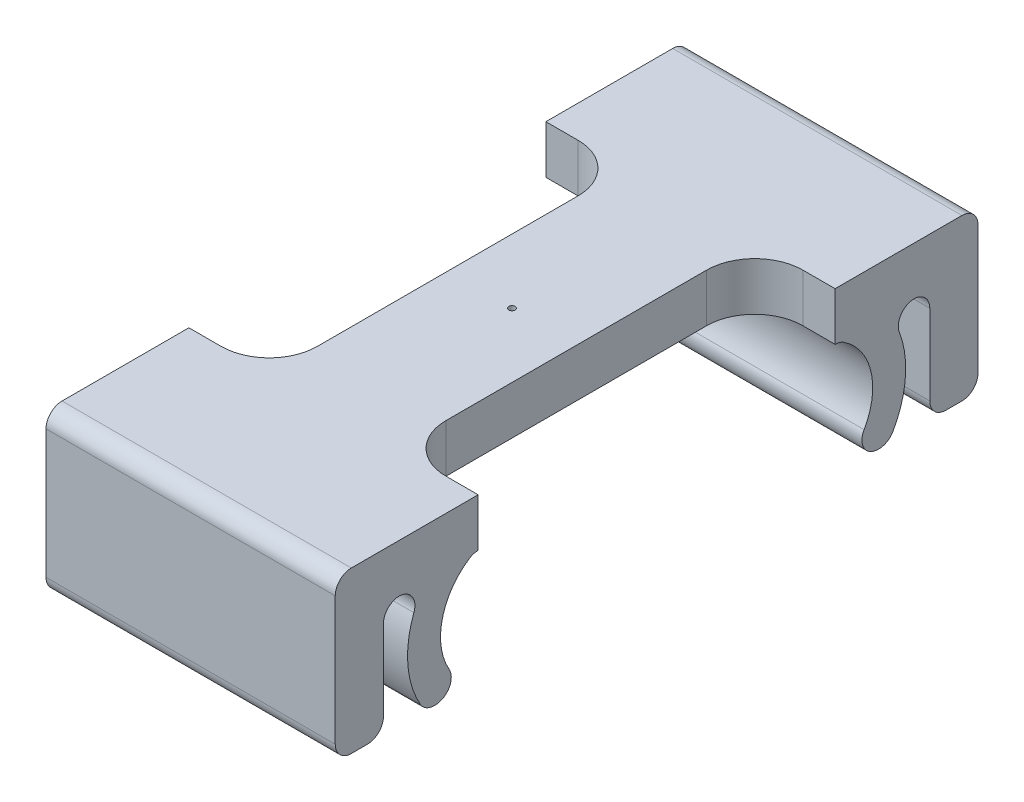
from build123d import *
from build123d.topology import SkipClean

# Parameters (mm, degrees)
EXTRUDE_1_DEPTH      = 4
EXTRUDE_1_DEPTH_BACK = 4
FILLET_4_R           = 1
EXTRUDE_2_DEPTH      = 5
FILLET_5_R           = 3
SKETCH_5_R           = 0.2
CUT_EXTRUDE_1_DEPTH  = 54.051861419


with BuildPart() as part:
    # Эскиз1 → Бобышка-Вытянуть1 (new, two sides: drawn at the far end of the back side and taken through both)
    with BuildSketch(Plane(origin=(22.5, -18, -41), x_dir=(0, -1, 0), z_dir=(1, 0, 0)).offset(-EXTRUDE_1_DEPTH_BACK)):
        with BuildLine():
            Line((-51, -2.5), (-51, 0.5))
            Line((-51, 0.5), (-61, 0.5))
            Line((-61, 0.5), (-61, -39.5))
            Line((-61, -39.5), (-51, -39.5))
            Line((-51, -39.5), (-51, -36.5))
            Line((-51, -36.5), (-58, -36.5))
            Line((-58, -36.5), (-58, -33.885132318))
            ThreePointArc((-58, -33.885132318), (-54.5, -35), (-51, -33.885132318))
            Line((-51, -33.885132318), (-51, -30.885132318))
            ThreePointArc((-51, -30.885132318), (-54.5, -32.948640645), (-58, -30.885132318))
            Line((-58, -30.885132318), (-58, -8.114867682))
            ThreePointArc((-58, -8.114867682), (-54.5, -6.051359355), (-51, -8.114867682))
            Line((-51, -8.114867682), (-51, -5.114867682))
            ThreePointArc((-51, -5.114867682), (-54.5, -4), (-58, -5.114867682))
            Line((-58, -5.114867682), (-58, -2.5))
            Line((-58, -2.5), (-51, -2.5))
        make_face()
    extrude(amount=EXTRUDE_1_DEPTH + EXTRUDE_1_DEPTH_BACK)

    # Скругление4
    # the kernel refuses this fillet: 1 mm, written as the material it adds along each edge
    with BuildSketch(Plane(origin=(26.5, 40, -38.5), x_dir=(0, 0, 1), z_dir=(-1, 0, 0)), Plane(origin=(18.5, 40, -4.5), x_dir=(0, 0, -1), z_dir=(1, 0, 0))) as fillet_4_piece_1:
        with BuildLine():
            CenterArc((FILLET_4_R, -FILLET_4_R), FILLET_4_R, 90, 90)
            Line((0, -FILLET_4_R), (0, 0))
            Line((0, 0), (FILLET_4_R, 0))
        make_face()
    extrude(amount=8)
    with BuildSketch(Plane(origin=(26.5, 40, -35.885132318), x_dir=(0, 0, -1), z_dir=(-1, 0, 0))) as fillet_4_piece_2:
        with BuildLine():
            CenterArc((1.65681317, 1), FILLET_4_R, 159.234649254, 110.765350746)
            ThreePointArc((0.721772915, 1.354541568), (0.404005567, 0.654294593), (0, 0))
            Line((0, 0), (1.65681317, 0))
        make_face()
    extrude(amount=8)
    with BuildSketch(Plane(origin=(18.5, 40, -32.885132318), x_dir=(0, -0.5188652741265531, -0.8548560272382577), z_dir=(1, 0, 0))) as fillet_4_piece_3:
        with BuildLine():
            CenterArc((0.281062042, -0.999193595), FILLET_4_R, 87.698857305, 33.557309762)
            Line((-0.237803232, -0.144337567), (0, 0))
            ThreePointArc((0, 0), (0.160606881, 0.003225622), (0.321213762, 0))
        make_face()
    extrude(amount=8)
    with BuildSketch(Plane(origin=(18.5, 40, -10.114867682), x_dir=(0, 0, -1), z_dir=(1, 0, 0))) as fillet_4_piece_4:
        with BuildLine():
            CenterArc((0.278179278, -1), FILLET_4_R, 90, 33.557309762)
            ThreePointArc((-0.27459152, -0.166666667), (-0.138969423, -0.080575891), (0, 0))
            Line((0, 0), (0.278179278, 0))
        make_face()
    extrude(amount=8)
    with BuildSketch(Plane(origin=(18.5, 40, -7.114867682), x_dir=(0, -0.8825285241752726, 0.4702588691529541), z_dir=(1, 0, 0))) as fillet_4_piece_5:
        with BuildLine():
            CenterArc((1.661659612, -0.991926012), FILLET_4_R, 97.285750856, 110.765350746)
            Line((0.779131087, -1.462184881), (0, 0))
            ThreePointArc((0, 0), (0.767420843, -0.048858602), (1.534841686, 0))
        make_face()
    extrude(amount=8)
    # the kernel refuses this fillet: 1 mm, written as the material it takes off along each edge
    with BuildSketch(Plane(origin=(17.002810413, 33, -35.885132318), x_dir=(0, 0, 1), z_dir=(1, 0, 0))) as fillet_4_2_piece_1:
        with BuildLine():
            CenterArc((0.547160138, -1), FILLET_4_R, 90, 60.33576985)
            ThreePointArc((-0.321780523, -0.505083716), (-0.167142324, -0.248558772), (0, 0))
            Line((0, 0), (0.547160138, 0))
        make_face()
    extrude(amount=10.994379174, mode=Mode.SUBTRACT)
    with BuildSketch(Plane(origin=(12.515911635, 33, -32.885132318), x_dir=(0, 0.7006292692220382, -0.7135254915624197), z_dir=(1, 0, 0))) as fillet_4_2_piece_2:
        with BuildLine():
            CenterArc((2.408549106, -0.963525492), FILLET_4_R, 105.522487814, 120)
            Line((1.707919837, -1.677050983), (0, 0))
            ThreePointArc((0, 0), (1.070466269, -0.145898034), (2.140932539, 0))
        make_face()
    extrude(amount=19.968176729, mode=Mode.SUBTRACT)
    with BuildSketch(Plane(origin=(12.515911635, 33, -10.114867682), x_dir=(0, 0, 1), z_dir=(1, 0, 0))) as fillet_4_2_piece_3:
        with BuildLine():
            CenterArc((2.393635346, -1), FILLET_4_R, 90, 120)
            ThreePointArc((1.527609942, -1.5), (0.866025404, -0.645898034), (0, 0))
            Line((0, 0), (2.393635346, 0))
        make_face()
    extrude(amount=19.968176729, mode=Mode.SUBTRACT)
    with BuildSketch(Plane(origin=(17.002810413, 33, -7.114867682), x_dir=(0, 0.8433863696195878, 0.5373075762911708), z_dir=(1, 0, 0))) as fillet_4_2_piece_4:
        with BuildLine():
            CenterArc((0.549393082, -0.998774978), FILLET_4_R, 87.163688846, 60.33576985)
            Line((-0.293993287, -0.461467402), (0, 0))
            ThreePointArc((0, 0), (0.299437917, 0.007413047), (0.598875835, 0))
        make_face()
    extrude(amount=10.994379174, mode=Mode.SUBTRACT)
    with BuildSketch(Plane(origin=(16, 33, -4.5), x_dir=(0, 0, 1), z_dir=(1, 0, 0)), Plane(origin=(16, 33, -1.5), x_dir=(0, 1, 0), z_dir=(1, 0, 0)), Plane(origin=(16, 43, -1.5), x_dir=(0, 0, -1), z_dir=(1, 0, 0)), Plane(origin=(16, 43, -41.5), x_dir=(0, -1, 0), z_dir=(1, 0, 0)), Plane(origin=(16, 33, -41.5), x_dir=(0, 0, 1), z_dir=(1, 0, 0)), Plane(origin=(29, 33, -38.5), x_dir=(0, 0, -1), z_dir=(-1, 0, 0))) as fillet_4_2_piece_5:
        with BuildLine():
            CenterArc((FILLET_4_R, -FILLET_4_R), FILLET_4_R, 90, 90)
            Line((0, -FILLET_4_R), (0, 0))
            Line((0, 0), (FILLET_4_R, 0))
        make_face()
    extrude(amount=13, mode=Mode.SUBTRACT)

    # Эскиз3 → Бобышка-Вытянуть2 (add)
    with SkipClean():  # the faces are left unmerged after this step: merging them gives an invalid solid
        with BuildSketch(Plane(origin=(26.5, 0, 0), x_dir=(0, 0, -1), z_dir=(1, 0, 0))):
            with BuildLine():
                Line((10.393046959, 40), (10.393046959, 43))
                Line((10.393046959, 43), (2.5, 43))
                ThreePointArc((2.5, 43), (1.792893219, 42.707106781), (1.5, 42))
                Line((1.5, 42), (1.5, 34))
                ThreePointArc((1.5, 34), (1.792893219, 33.292893219), (2.5, 33))
                Line((2.5, 33), (3.5, 33))
                ThreePointArc((3.5, 33), (4.207106781, 33.292893219), (4.5, 34))
                Line((4.5, 34), (4.5, 39))
                ThreePointArc((4.5, 39), (4.78551671, 39.699652505), (5.479027256, 39.999780048))
                ThreePointArc((5.479027256, 39.999780048), (6.286931447, 39.559430985), (6.393094766, 38.645458432))
                ThreePointArc((6.393094766, 38.645458432), (6.0182377, 36.030539524), (6.793087158, 33.505083716))
                ThreePointArc((6.793087158, 33.505083716), (7.159492389, 33.135443384), (7.662027819, 33))
                Line((7.662027819, 33), (7.721232336, 33))
                ThreePointArc((7.721232336, 33), (8.587257739, 33.5), (8.587257739, 34.5))
                ThreePointArc((8.587257739, 34.5), (8.157384295, 37.414854216), (9.840276161, 39.833333333))
                ThreePointArc((9.840276161, 39.833333333), (10.104371825, 39.957427108), (10.393046959, 40))
            make_face()
            with BuildLine():
                Line((32.606953041, 40), (32.606953041, 43))
                Line((32.606953041, 43), (40.5, 43))
                ThreePointArc((40.5, 43), (41.207106781, 42.707106781), (41.5, 42))
                Line((41.5, 42), (41.5, 34))
                ThreePointArc((41.5, 34), (41.207106781, 33.292893219), (40.5, 33))
                Line((40.5, 33), (39.5, 33))
                ThreePointArc((39.5, 33), (38.792893219, 33.292893219), (38.5, 34))
                Line((38.5, 34), (38.5, 39))
                ThreePointArc((38.5, 39), (38.21448329, 39.699652505), (37.520972744, 39.999780048))
                ThreePointArc((37.520972744, 39.999780048), (36.713068553, 39.559430985), (36.606905234, 38.645458432))
                ThreePointArc((36.606905234, 38.645458432), (36.9817623, 36.030539524), (36.206912842, 33.505083716))
                ThreePointArc((36.206912842, 33.505083716), (35.840507611, 33.135443384), (35.337972181, 33))
                Line((35.337972181, 33), (35.278767664, 33))
                ThreePointArc((35.278767664, 33), (34.412742261, 33.5), (34.412742261, 34.5))
                ThreePointArc((34.412742261, 34.5), (34.842615705, 37.414854216), (33.159723839, 39.833333333))
                ThreePointArc((33.159723839, 39.833333333), (32.895628175, 39.957427108), (32.606953041, 40))
            make_face()
        extrude_2 = extrude(amount=EXTRUDE_2_DEPTH)

    # Зеркальное отражение1: Бобышка-Вытянуть2 across plane
    with SkipClean():  # the faces are left unmerged after this step: merging them gives an invalid solid
        add(extrude_2.mirror(Plane(origin=(22.5, 0, 0), x_dir=(0, 0, 1), z_dir=(1, 0, 0))))

    # Скругление5
    # the kernel refuses this fillet: 3 mm, written as the material it adds along each edge
    with BuildSketch(Plane(origin=(26.5, 40, -32.606953041), x_dir=(0, 0, 1), z_dir=(0, 1, 0)), Plane(origin=(26.5, 40, -10.393046959), x_dir=(1, 0, 0), z_dir=(0, 1, 0))) as fillet_5_piece_1:
        with BuildLine():
            CenterArc((FILLET_5_R, FILLET_5_R), FILLET_5_R, 180, 90)
            Line((0, FILLET_5_R), (0, 0))
            Line((0, 0), (FILLET_5_R, 0))
        make_face()
    extrude(amount=3)
    with BuildSketch(Plane(origin=(18.5, 40, -32.606953041), x_dir=(0, 0, 1), z_dir=(0, 1, 0)), Plane(origin=(18.5, 40, -10.393046959), x_dir=(-1, 0, 0), z_dir=(0, 1, 0))) as fillet_5_piece_2:
        with BuildLine():
            CenterArc((FILLET_5_R, -FILLET_5_R), FILLET_5_R, 90, 90)
            Line((0, -FILLET_5_R), (0, 0))
            Line((0, 0), (FILLET_5_R, 0))
        make_face()
    extrude(amount=3)

    # Эскиз5 → Вырез-Вытянуть1 (cut, through all)
    with BuildSketch(Plane(origin=(0, 43, 0), x_dir=(1, 0, 0), z_dir=(0, 1, 0))):
        with Locations(Location((22.5, 21.5, 0), (0, 0, 180))):
            Circle(SKETCH_5_R)
    extrude(amount=-CUT_EXTRUDE_1_DEPTH, mode=Mode.SUBTRACT)


solid = part.part
